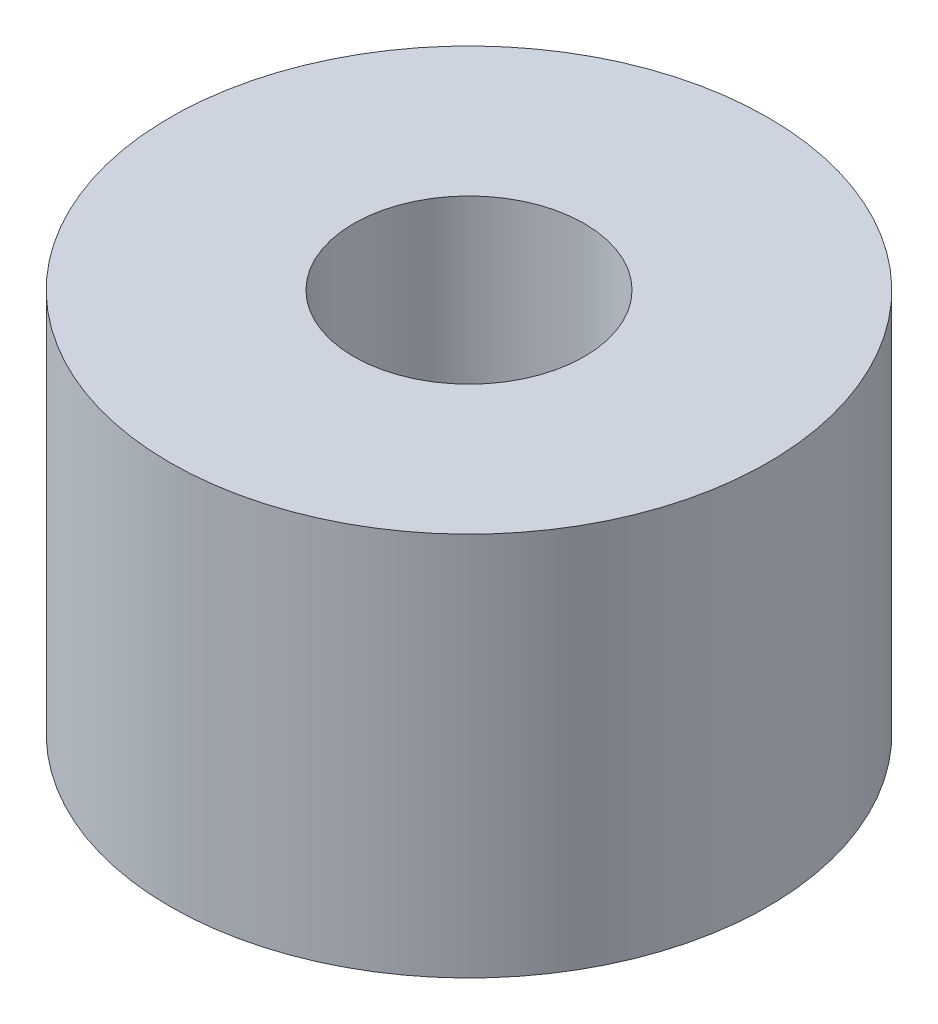
from build123d import *

# Parameters (mm, degrees)
SKETCH1_R           = 22.225
SKETCH1_R_2         = 8.5725
BOSS_EXTRUDE1_DEPTH = 28.575
SKETCH2_R           = 8.5725
CUT_EXTRUDE1_DEPTH  = 9.921875
FILLET1_R           = 3.175


with BuildPart() as part:
    # Sketch1 → Boss-Extrude1 (new body)
    with BuildSketch(Plane(origin=(0, 0, 0), x_dir=(1, 0, 0), z_dir=(0, 1, 0))):
        Circle(SKETCH1_R)
        Circle(SKETCH1_R_2, mode=Mode.SUBTRACT)
    extrude(amount=BOSS_EXTRUDE1_DEPTH)

    # Sketch2 → Cut-Extrude1 (cut)
    with BuildSketch(Plane.XZ):
        with BuildLine():
            Line((5.334, 11.988389665), (-5.334, 11.988389665))
            ThreePointArc((-5.334, 11.988389665), (-7.71525, 13.363204993), (-7.71525, 10.613574336))
            Line((-7.71525, 10.613574336), (-13.04925, 1.374815329))
            ThreePointArc((-13.04925, 1.374815329), (-15.4305, 0), (-13.04925, -1.374815329))
            Line((-13.04925, -1.374815329), (-7.71525, -10.613574336))
            ThreePointArc((-7.71525, -10.613574336), (-7.71525, -13.363204993), (-5.334, -11.988389665))
            Line((-5.334, -11.988389665), (5.334, -11.988389665))
            ThreePointArc((5.334, -11.988389665), (7.71525, -13.363204993), (7.71525, -10.613574336))
            Line((7.71525, -10.613574336), (13.04925, -1.374815329))
            ThreePointArc((13.04925, -1.374815329), (15.4305, 0), (13.04925, 1.374815329))
            Line((13.04925, 1.374815329), (7.71525, 10.613574336))
            ThreePointArc((7.71525, 10.613574336), (7.71525, 13.363204993), (5.334, 11.988389665))
        make_face()
        Circle(SKETCH2_R, mode=Mode.SUBTRACT)
    extrude(amount=-CUT_EXTRUDE1_DEPTH, mode=Mode.SUBTRACT)

    # Fillet1
    fillet1_edges = [part.edges().sort_by_distance(p)[0] for p in [
        (-13.04925, 4.9609375, -1.374815329),
        (-7.71525, 4.9609375, -10.613574336),
        (-5.334, 4.9609375, -11.988389665),
        (5.334, 4.9609375, -11.988389665),
        (7.71525, 4.9609375, -10.613574336),
        (13.04925, 4.9609375, -1.374815329),
        (13.04925, 4.9609375, 1.374815329),
        (7.71525, 4.9609375, 10.613574336),
        (5.334, 4.9609375, 11.988389665),
        (-5.334, 4.9609375, 11.988389665),
        (-7.71525, 4.9609375, 10.613574336),
        (-13.04925, 4.9609375, 1.374815329),
    ]]
    fillet(fillet1_edges, radius=FILLET1_R)


solid = part.part
